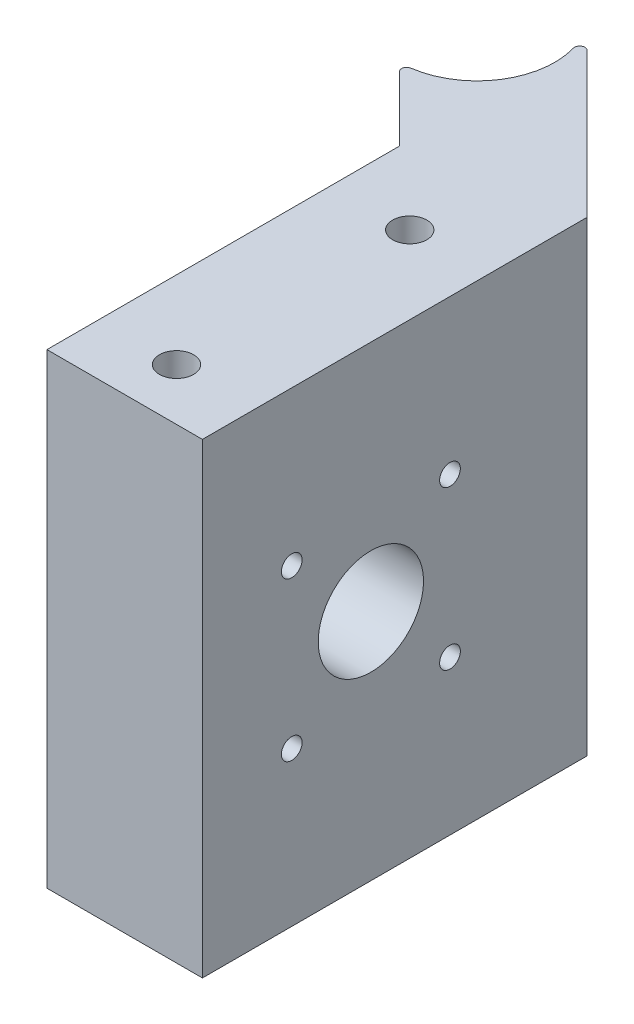
from build123d import *

# Parameters (mm, degrees)
SKETCH1_R           = 1.6500000000000001
SKETCH1_R_2         = 1.6499999999999997
BOSS_EXTRUDE1_DEPTH = 45
CUT_EXTRUDE1_REACH  = 71.934
SKETCH2_R           = 5.0800000000000045
SKETCH2_R_2         = 1.0000000000000009
SKETCH2_R_3         = 1.0000000000000018
FILLET1_R           = 0.5
CUT_EXTRUDE2_DEPTH  = 2
CUT_EXTRUDE3_START  = 17
CUT_EXTRUDE3_DEPTH  = 2


with BuildPart() as part:
    # Sketch1 → Boss-Extrude1 (new body)
    with BuildSketch(Plane(origin=(0, 0, 0), x_dir=(1, 0, 0), z_dir=(0, 1, 0))):
        with BuildLine():
            Line((-7.499999999999999, -5.000000000000001), (7.500000000000001, -4.999999999999999))
            Line((7.500000000000001, -5), (7.499999999999998, 32.10660171779804))
            Line((7.499999999999998, 32.10660171779804), (-9.196699141100867, 48.80330085889908))
            ThreePointArc((-9.196699141100867, 48.80330085889908), (-7.57090350616536, 40.62987425726181), (-14.499999999999998, 36))
            Line((-14.499999999999998, 36), (-7.5, 28.999999999999925))
            Line((-7.5, 28.99999999999993), (-7.499999999999999, -5.000000000000001))
        make_face()
        Circle(SKETCH1_R, mode=Mode.SUBTRACT)
        with Locations((0, 22.5)):
            Circle(SKETCH1_R_2, mode=Mode.SUBTRACT)
    extrude(amount=BOSS_EXTRUDE1_DEPTH)

    # Sketch2 → Cut-Extrude1 (cut, up to next)
    with BuildSketch(Plane(origin=(7.500000000000001, 0, -5.3e-16), x_dir=(-1.2e-16, 0, -1), z_dir=(1, 0, -1.2e-16)), mode=Mode.PRIVATE) as cut_extrude1_sk1:
        with Locations((11.25, 22.5)):
            Circle(SKETCH2_R)
    cut_extrude1_tool1 = extrude(cut_extrude1_sk1.sketch, amount=-CUT_EXTRUDE1_REACH, mode=Mode.PRIVATE) & part.part
    # Sketch2 → Cut-Extrude1 (cut, up to next)
    with BuildSketch(Plane(origin=(7.500000000000001, 0, -5.3e-16), x_dir=(-1.2e-16, 0, -1), z_dir=(1, 0, -1.2e-16)), mode=Mode.PRIVATE) as cut_extrude1_sk2:
        with Locations((3.616999999999997, 30.133)):
            Circle(SKETCH2_R_2)
    cut_extrude1_tool2 = extrude(cut_extrude1_sk2.sketch, amount=-CUT_EXTRUDE1_REACH, mode=Mode.PRIVATE) & part.part
    # Sketch2 → Cut-Extrude1 (cut, up to next)
    with BuildSketch(Plane(origin=(7.500000000000001, 0, -5.3e-16), x_dir=(-1.2e-16, 0, -1), z_dir=(1, 0, -1.2e-16)), mode=Mode.PRIVATE) as cut_extrude1_sk3:
        with Locations((18.882999999999996, 30.133)):
            Circle(SKETCH2_R_3)
    cut_extrude1_tool3 = extrude(cut_extrude1_sk3.sketch, amount=-CUT_EXTRUDE1_REACH, mode=Mode.PRIVATE) & part.part
    # Sketch2 → Cut-Extrude1 (cut, up to next)
    with BuildSketch(Plane(origin=(7.500000000000001, 0, -5.3e-16), x_dir=(-1.2e-16, 0, -1), z_dir=(1, 0, -1.2e-16)), mode=Mode.PRIVATE) as cut_extrude1_sk4:
        with Locations((18.883, 14.867)):
            Circle(SKETCH2_R_3)
    cut_extrude1_tool4 = extrude(cut_extrude1_sk4.sketch, amount=-CUT_EXTRUDE1_REACH, mode=Mode.PRIVATE) & part.part
    # Sketch2 → Cut-Extrude1 (cut, up to next)
    with BuildSketch(Plane(origin=(7.500000000000001, 0, -5.3e-16), x_dir=(-1.2e-16, 0, -1), z_dir=(1, 0, -1.2e-16)), mode=Mode.PRIVATE) as cut_extrude1_sk5:
        with Locations((3.6169999999999987, 14.867)):
            Circle(SKETCH2_R_2)
    cut_extrude1_tool5 = extrude(cut_extrude1_sk5.sketch, amount=-CUT_EXTRUDE1_REACH, mode=Mode.PRIVATE) & part.part
    add(cut_extrude1_tool1.solids().sort_by_distance((7.5, 22.5, -11.25))[0], mode=Mode.SUBTRACT)
    add(cut_extrude1_tool2.solids().sort_by_distance((7.5, 30.133, -3.617))[0], mode=Mode.SUBTRACT)
    add(cut_extrude1_tool3.solids().sort_by_distance((7.5, 30.133, -18.883))[0], mode=Mode.SUBTRACT)
    add(cut_extrude1_tool4.solids().sort_by_distance((7.5, 14.867, -18.883))[0], mode=Mode.SUBTRACT)
    add(cut_extrude1_tool5.solids().sort_by_distance((7.5, 14.867, -3.617))[0], mode=Mode.SUBTRACT)

    # Fillet1
    fillet1_edges = [part.edges().sort_by_distance(p)[0] for p in [
        (-9.196699141100865, 22.5, -48.80330085889908),
        (-14.499999999999998, 22.5, -36),
    ]]
    fillet(fillet1_edges, radius=FILLET1_R)

    # Sketch3 → Cut-Extrude2 (cut, symmetric)
    with BuildSketch(Plane(origin=(0, 22.5, 0), x_dir=(1, 0, 0), z_dir=(0, 1, 0))):
        with BuildLine():
            Line((-8.136038969321103, 37.136038969321035), (-2.832738110421976, 42.43933982822012))
            Line((-2.832738110421976, 42.43933982822012), (-1.7720779386421608, 41.37867965644029))
            Line((-1.7720779386421608, 41.37867965644029), (-7.0753787975412905, 36.07537879754122))
            ThreePointArc((-7.0753787975412905, 36.07537879754122), (-9.276718417433413, 34.39135962345529), (-11.84199719101188, 33.34199719101184))
            Line((-11.84199719101188, 33.34199719101184), (-13.108259049699235, 34.608259049699214))
            ThreePointArc((-13.108259049699235, 34.608259049699214), (-10.421379383302025, 35.47722904072127), (-8.136038969321103, 37.136038969321035))
        make_face()
    extrude(amount=CUT_EXTRUDE2_DEPTH, both=True, mode=Mode.SUBTRACT)

    # Sketch3<2> → Cut-Extrude3 (cut, symmetric)
    with BuildSketch(Plane(origin=(0, 22.5, 0), x_dir=(1, 0, 0), z_dir=(0, 1, 0)).offset(CUT_EXTRUDE3_START)):
        with BuildLine():
            Line((-8.136038969321103, 37.136038969321035), (-2.832738110421976, 42.43933982822012))
            Line((-2.832738110421976, 42.43933982822012), (-1.7720779386421608, 41.37867965644029))
            Line((-1.7720779386421608, 41.37867965644029), (-7.0753787975412905, 36.07537879754122))
            ThreePointArc((-7.0753787975412905, 36.07537879754122), (-9.276718417433413, 34.39135962345529), (-11.84199719101188, 33.34199719101184))
            Line((-11.84199719101188, 33.34199719101184), (-13.108259049699235, 34.608259049699214))
            ThreePointArc((-13.108259049699235, 34.608259049699214), (-10.421379383302025, 35.47722904072127), (-8.136038969321103, 37.136038969321035))
        make_face()
    cut_extrude3 = extrude(amount=CUT_EXTRUDE3_DEPTH, both=True, mode=Mode.SUBTRACT)

    # Mirror1: Cut-Extrude3 across plane
    add(cut_extrude3.mirror(Plane.ZX.offset(22.5)), mode=Mode.SUBTRACT)


solid = part.part
